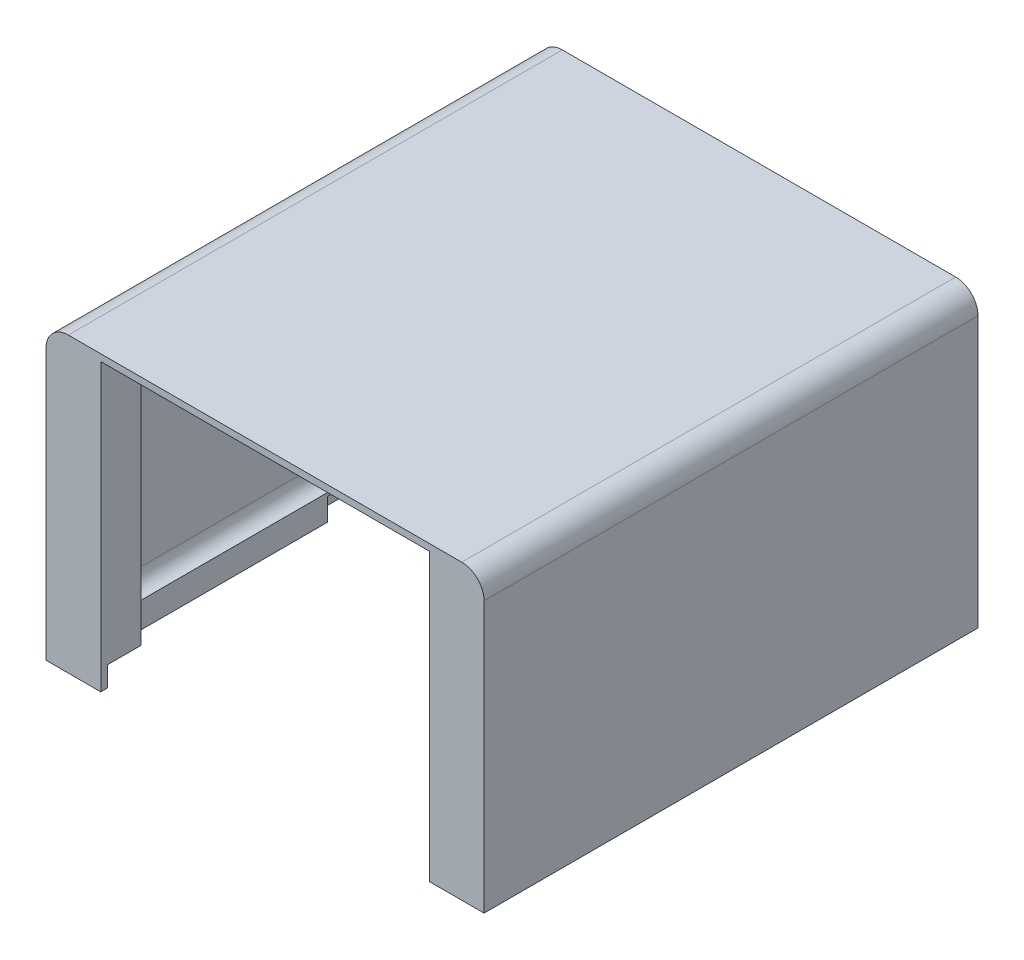
from build123d import *

# Parameters (mm, degrees)
SKETCH_1_W          = 196
SKETCH_1_H          = 221
EXTRUDE_1_DEPTH     = 3
EXTRUDE_2_DEPTH     = 128
FILLET_1_R          = 10
FILLET_2_R          = 10
SKETCH_3_R          = 3
SKETCH_3_R_2        = 40
CUT_EXTRUDE_1_DEPTH = 5
FILLET_3_R          = 10
FILLET_4_R          = 10
SKETCH_5_R          = 40
SKETCH_5_R_2        = 34
EXTRUDE_3_DEPTH     = 3
SKETCH_6_W          = 15
SKETCH_6_H          = 9
CUT_EXTRUDE_3_DEPTH = 159
EXTRUDE_4_DEPTH     = 10
EXTRUDE_4_2_DEPTH   = 10
EXTRUDE_4_3_DEPTH   = 10
EXTRUDE_4_4_DEPTH   = 10
EXTRUDE_6_DEPTH     = 1.5
FILLET_START        = -219
FILLET_6_DEPTH      = 216
FILLET_7_R          = 6.5
FILLET_8_R          = 8.5
FILLET_9_R          = 8.5
CUT_EXTRUDE_4_DEPTH = 10


with BuildPart() as part:
    # 草图1 → 凸台-拉伸1 (new body)
    with BuildSketch(Plane(origin=(0, 0, 0), x_dir=(1, 0, 0), z_dir=(0, 1, 0))):
        with Locations((98, 110.5)):
            Rectangle(SKETCH_1_W, SKETCH_1_H)
    extrude(amount=EXTRUDE_1_DEPTH)

    # 草图2 → 凸台-拉伸2 (add)
    with BuildSketch(Plane(origin=(0, 0, 0), x_dir=(1, 0, 0), z_dir=(0, 1, 0))):
        Polygon((3, 218), (3, 3), (20.5, 3), (20.5, 18), (24.5, 18), (24.5, 3), (24.5, 0), (0, 0), (0, 221), (196, 221), (196, 0), (171.5, 0), (171.5, 3), (171.5, 18), (175.5, 18), (175.5, 3), (193, 3), (193, 218), align=None)
    extrude(amount=-EXTRUDE_2_DEPTH)

    # 圆角1
    fillet_1_edges = [part.edges().sort_by_distance(p)[0] for p in [
        (0, 3, -110.5),
    ]]
    fillet(fillet_1_edges, radius=FILLET_1_R)

    # 圆角2
    fillet_2_edges = [part.edges().sort_by_distance(p)[0] for p in [
        (196, 3, -110.5),
    ]]
    fillet(fillet_2_edges, radius=FILLET_2_R)

    # 草图3 → 切除-拉伸1 (cut)
    with BuildSketch(Plane(origin=(0, 0, -221), x_dir=(-1, 0, 0), z_dir=(0, 0, -1))):
        with Locations((-133.75, -9)):
            Circle(SKETCH_3_R)
        with Locations((-62.25, -9)):
            Circle(SKETCH_3_R)
        with Locations((-62.25, -80.5)):
            Circle(SKETCH_3_R)
        with Locations((-133.75, -80.5)):
            Circle(SKETCH_3_R)
        with Locations((-98, -44.75)):
            Circle(SKETCH_3_R_2)
    extrude(amount=-CUT_EXTRUDE_1_DEPTH, mode=Mode.SUBTRACT)

    # 圆角3
    fillet_3_edges = [part.edges().sort_by_distance(p)[0] for p in [
        (193, 0, -110.5),
    ]]
    fillet(fillet_3_edges, radius=FILLET_3_R)

    # 圆角4
    fillet_4_edges = [part.edges().sort_by_distance(p)[0] for p in [
        (3, 0, -110.5),
    ]]
    fillet(fillet_4_edges, radius=FILLET_4_R)

    # 草图5 → 凸台-拉伸3 (add)
    with BuildSketch(Plane(origin=(0, 0, -221), x_dir=(-1, 0, 0), z_dir=(0, 0, -1))):
        with Locations((-98, -44.75)):
            Circle(SKETCH_5_R)
        with Locations((-98, -44.75)):
            Circle(SKETCH_5_R_2, mode=Mode.SUBTRACT)
    extrude(amount=-EXTRUDE_3_DEPTH)

    # 草图6 → 切除-拉伸3 (cut)
    with BuildSketch(Plane(origin=(175.5, 0, 0), x_dir=(0, 0, -1), z_dir=(1, 0, 0))):
        with Locations((10.5, -123.5)):
            Rectangle(SKETCH_6_W, SKETCH_6_H)
    extrude(amount=-CUT_EXTRUDE_3_DEPTH, mode=Mode.SUBTRACT)



with BuildPart() as body_2:
    # 草图10 → 凸台-拉伸4 (new body)
    with BuildSketch(Plane(origin=(0, -128, 0), x_dir=(-1, 0, 0), z_dir=(0, -1, 0))):
        Polygon((-5.5, 213.5), (-5.5, 143.5), (-9.5, 143.5), (-9.5, 209.5), (-35.5, 209.5), (-35.5, 213.5), align=None)
    extrude(amount=-EXTRUDE_4_DEPTH)


with BuildPart() as body_3:
    # 草图10 → Extrude 4 2 (new body)
    with BuildSketch(Plane(origin=(0, -128, 0), x_dir=(-1, 0, 0), z_dir=(0, -1, 0))):
        Polygon((-190.5, 213.5), (-160.5, 213.5), (-160.5, 209.5), (-186.5, 209.5), (-186.5, 143.5), (-190.5, 143.5), align=None)
    extrude(amount=-EXTRUDE_4_2_DEPTH)


with BuildPart() as body_4:
    # 草图10 → Extrude 4 3 (new body)
    with BuildSketch(Plane(origin=(0, -128, 0), x_dir=(-1, 0, 0), z_dir=(0, -1, 0))):
        Polygon((-16.5, 6.5), (-16.5, 10.5), (-9.5, 10.5), (-9.5, 116.5), (-5.5, 116.5), (-5.5, 6.5), align=None)
    extrude(amount=-EXTRUDE_4_3_DEPTH)


with BuildPart() as body_5:
    # 草图10 → Extrude 4 4 (new body)
    with BuildSketch(Plane(origin=(0, -128, 0), x_dir=(-1, 0, 0), z_dir=(0, -1, 0))):
        Polygon((-190.5, 6.5), (-179.5, 6.5), (-179.5, 10.5), (-186.5, 10.5), (-186.5, 116.5), (-190.5, 116.5), align=None)
    extrude(amount=-EXTRUDE_4_4_DEPTH)


with BuildPart() as part_1:
    add(part.part)

    add(body_2.part)  # 凸台-拉伸6 merges body 2

    add(body_3.part)  # 凸台-拉伸6 merges body 3

    add(body_4.part)  # 凸台-拉伸6 merges body 4

    add(body_5.part)  # 凸台-拉伸6 merges body 5
    # 草图11 → 凸台-拉伸6 (add)
    with BuildSketch(Plane(origin=(0, -118, 0), x_dir=(1, 0, 0), z_dir=(0, 1, 0))):
        Polygon((179.5, 6.5), (179.5, 3), (193, 3), (193, 218), (160.5, 218), (160.5, 209.5), (186.5, 209.5), (186.5, 10.5), (179.5, 10.5), align=None)
        Polygon((16.5, 10.5), (16.5, 3), (3, 3), (3, 218), (35.5, 218), (35.5, 209.5), (9.5, 209.5), (9.5, 10.5), align=None)
    extrude(amount=EXTRUDE_6_DEPTH)

    # 圆角6: read off the stored shape, not the designer's step
    # 圆角6 outline → 圆角6 (add)
    with BuildSketch(Plane.XY.offset(FILLET_START)):
        with BuildLine():
            Line((3, -116.5), (9.5, -116.5))
            ThreePointArc((9.5, -116.5), (4.903805922, -114.596194078), (3, -110))
            Line((3, -110), (3, -116.5))
        make_face()
    extrude(amount=FILLET_6_DEPTH)

    # 圆角7
    fillet_7_edges = [part_1.edges().sort_by_distance(p)[0] for p in [
        (193, -116.5, -110.5),
    ]]
    fillet(fillet_7_edges, radius=FILLET_7_R - 0.0001)  # a hair under: the kernel refuses the full size

    # 圆角8
    # the kernel refuses this fillet: 8.5 mm, written as the material it adds along each edge
    with BuildSketch(Plane(origin=(-11.75, -116.5, -218), x_dir=(0, 1, 0), z_dir=(1, 0, 0))) as fillet_8_piece_1_section:
        with BuildLine():
            CenterArc((FILLET_8_R, FILLET_8_R), FILLET_8_R, 180, 90)
            Line((0, FILLET_8_R), (0, 0))
            Line((0, 0), (FILLET_8_R, 0))
        make_face()
    fillet_8_piece_1 = extrude(amount=47.25, mode=Mode.PRIVATE)
    fillet_8_piece_1 = split(fillet_8_piece_1, bisect_by=Plane(origin=(0, -116.5, -218), z_dir=(1, 0, 0)), keep=Keep.TOP, mode=Mode.PRIVATE)
    add(fillet_8_piece_1)

    # 圆角9
    # the kernel refuses this fillet: 8.5 mm, written as the material it adds along each edge
    with BuildSketch(Plane(origin=(207.7501, -116.5, -218), x_dir=(0, 0, 1), z_dir=(-1, 0, 0))) as fillet_9_piece_1_section:
        with BuildLine():
            CenterArc((FILLET_9_R, FILLET_9_R), FILLET_9_R, 180, 90)
            Line((0, FILLET_9_R), (0, 0))
            Line((0, 0), (FILLET_9_R, 0))
        make_face()
    fillet_9_piece_1 = extrude(amount=47.2501, mode=Mode.PRIVATE)
    fillet_9_piece_1 = split(fillet_9_piece_1, bisect_by=Plane(origin=(196, -116.5, -218), z_dir=(-1, 0, 0)), keep=Keep.TOP, mode=Mode.PRIVATE)
    add(fillet_9_piece_1)

    # 草图12 → 切除-拉伸4 (cut)
    with BuildSketch(Plane(origin=(0, -128, 0), x_dir=(-1, 0, 0), z_dir=(0, -1, 0))):
        Polygon((-16.5, 6.5), (-5.5, 6.5), (-5.5, 213.5), (-35.5, 213.5), (-35.5, 212.5), (-6.5, 212.5), (-6.5, 7.5), (-16.5, 7.5), align=None)
        Polygon((-190.5, 213.5), (-190.5, 6.5), (-179.5, 6.5), (-179.5, 7.5), (-189.5, 7.5), (-189.5, 212.5), (-160.5, 212.5), (-160.5, 213), (-160.5, 213.5), align=None)
    extrude(amount=-CUT_EXTRUDE_4_DEPTH, mode=Mode.SUBTRACT)


solid = part_1.part
